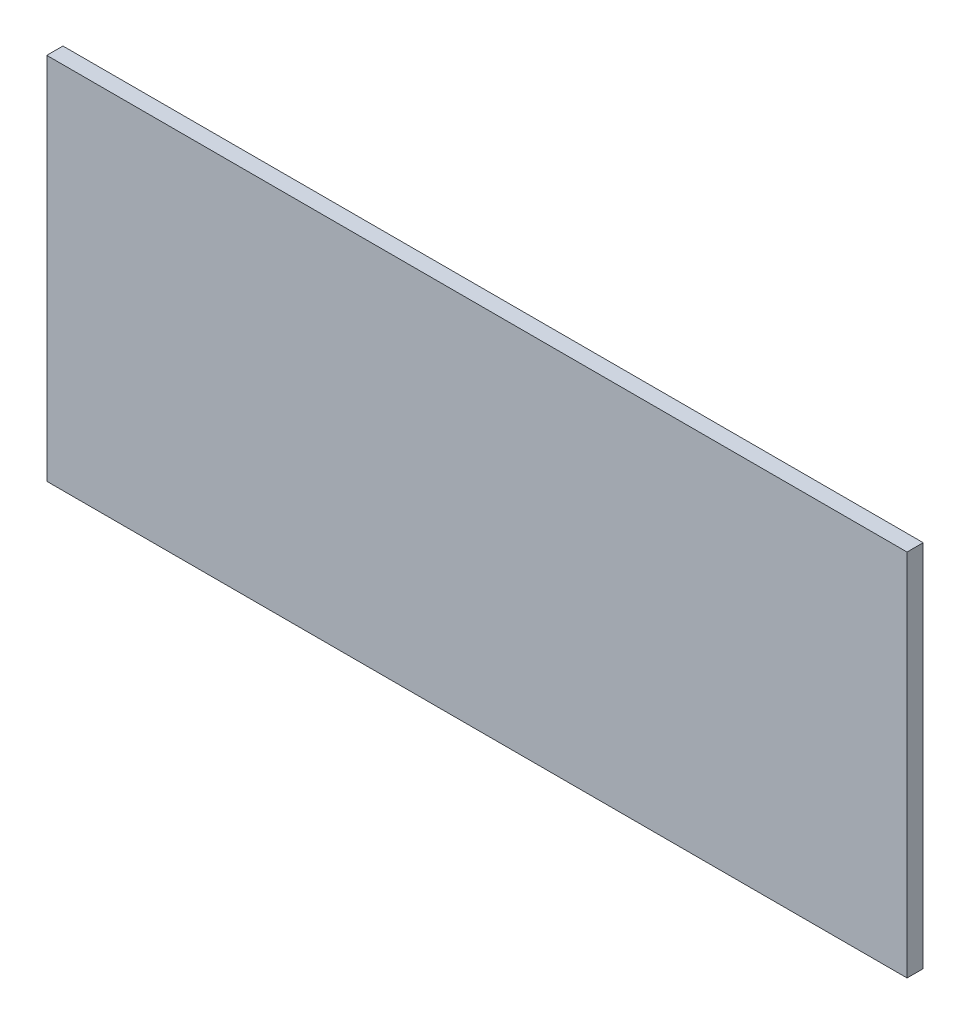
from build123d import *

# Parameters (mm, degrees)
SKETCH2_W          = 159.574581504
SKETCH2_H          = 68.426848692
BASE_FLANGE1_DEPTH = 3


# Sheet-metal steps are written as plain solids
with BuildPart() as part:
    # Sketch2 → Base-Flange1 (new body)
    with BuildSketch(Plane.XY):
        Rectangle(SKETCH2_W, SKETCH2_H)
    extrude(amount=-BASE_FLANGE1_DEPTH)


solid = part.part
